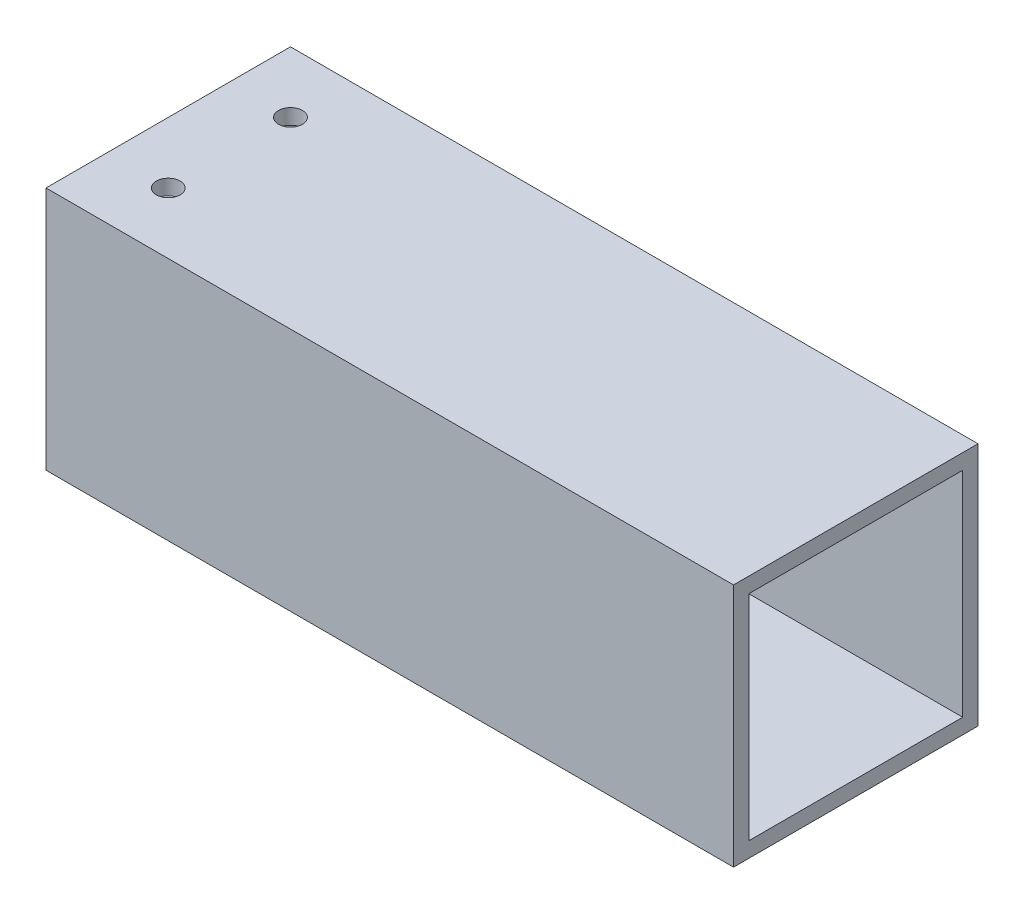
from build123d import *

# Parameters (mm, degrees)
SKETCH1_W           = 50.8
SKETCH1_H           = 50.8
BOSS_EXTRUDE1_DEPTH = 142.875
SHELL1_T            = -3.175
SKETCH3_R           = 2.4892
CUT_EXTRUDE2_DEPTH  = 160.920435295
LPATTERN1_COUNT     = 6
LPATTERN1_PITCH     = 25.4


with BuildPart() as part:
    # Sketch1 → Boss-Extrude1 (new body)
    with BuildSketch(Plane(origin=(0, 0, 0), x_dir=(0, 0, -1), z_dir=(1, 0, 0))):
        with Locations((25.4, 25.4)):
            Rectangle(SKETCH1_W, SKETCH1_H)
    extrude(amount=BOSS_EXTRUDE1_DEPTH)

    # Shell1
    shell1_openings = [part.faces().sort_by_distance(p)[0] for p in [
        (0, 25.4, -25.4),
        (142.875, 25.4, -25.4),
    ]]
    offset(amount=SHELL1_T, openings=shell1_openings, kind=Kind.INTERSECTION)

    # Sketch3 → Cut-Extrude2 (cut, through all)
    with BuildSketch(Plane.XZ):
        with Locations((12.7, -12.7)):
            Circle(SKETCH3_R)
        with Locations((12.7, -38.1)):
            Circle(SKETCH3_R)
    cut_extrude2 = extrude(amount=-CUT_EXTRUDE2_DEPTH, mode=Mode.SUBTRACT)

    # LPattern1: Cut-Extrude2 ×6
    with Locations(*[(-i * LPATTERN1_PITCH, 0, 0) for i in range(1, LPATTERN1_COUNT)]):
        add(cut_extrude2, mode=Mode.SUBTRACT)


solid = part.part
